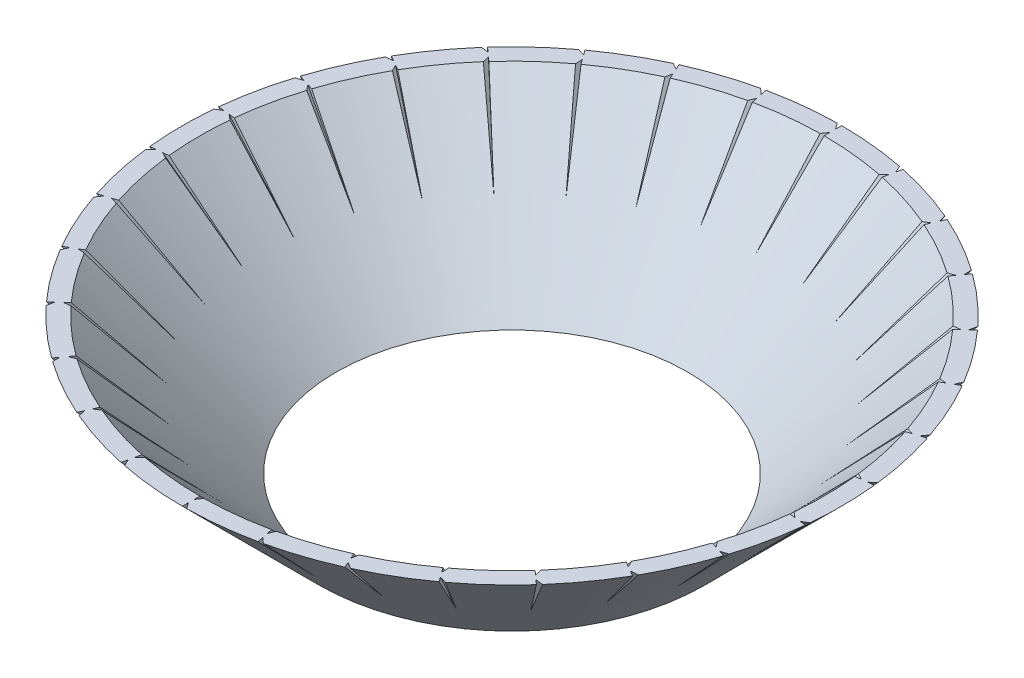
from build123d import *

# Parameters (mm, degrees)
CIRPATTERN1_COUNT = 30


with BuildPart() as part:
    # Sketch1 → Base-Revolve (revolve)
    with BuildSketch(Plane(origin=(0, 0, 0), x_dir=(0, 0, -1), z_dir=(1, 0, 0))):
        Polygon((8.5, 0), (15.1, 6.6), (15.948528137, 6.6), (9.348528137, 0), align=None)
    revolve(axis=Axis((0, -30, 0), (0, 1, 0)))

    # Cut-Sweep1: sweep along a path in Sketch3
    with BuildLine(Plane(origin=(0, 0, 0), x_dir=(0, 0, -1), z_dir=(1, 0, 0))) as cut_sweep1_path:
        Line((11.8, 3.3), (16.464867099, 7.6))
    # Sketch5 → Cut-Sweep1 (sweep, cut)
    with BuildSketch(Plane(origin=(0, 3.3, -11.8), x_dir=(-1, 0, 0), z_dir=(0, 0.6777666558072859, -0.7352770636133076))):
        Polygon((0, 0), (0, 1), (1, 1), align=None)
    cut_sweep1 = sweep(path=cut_sweep1_path.line, mode=Mode.SUBTRACT)

    # Mirror2: Cut-Sweep1 across plane
    add(cut_sweep1.mirror(Plane(origin=(0, -4.462132034, -4.462132034), x_dir=(0, -0.7071067811865461, 0.707106781186549), z_dir=(0, -0.7071067811865489, -0.7071067811865461))), mode=Mode.SUBTRACT)

    # CirPattern1: Cut-Sweep1 ×30 about axis
    cirpattern1_axis = Axis((0, -30, 0), (0, 1, 0))
    for i in range(1, CIRPATTERN1_COUNT):
        add(cut_sweep1.rotate(cirpattern1_axis, i * 360 / CIRPATTERN1_COUNT), mode=Mode.SUBTRACT)

    # CirPattern1 copy 1: sweep along a path in CirPattern1 copy 1 path
    with BuildLine(Plane(origin=(-1.855458832, -8.924264069, -8.729247487), x_dir=(0, 1, 0), z_dir=(0.9781476007338057, 0, -0.20791169081775923))) as cirpattern1_copy_1_path:
        Line((11.8, -3.3), (16.464867099, -7.6))
    # CirPattern1 copy 1 sketch → CirPattern1 copy 1 (sweep, cut)
    with BuildSketch(Plane(origin=(-2.541567412, 2.875735931, -11.95713457), x_dir=(-0.9781476007338057, 0, 0.20791169081775923), z_dir=(-0.14091561138879177, 0.7352770636133049, -0.6629558282352747))):
        Polygon((0, 0), (0, -1), (1, -1), align=None)
    sweep(path=cirpattern1_copy_1_path.line, mode=Mode.SUBTRACT)

    # CirPattern1 copy 2: sweep along a path in CirPattern1 copy 2 path
    with BuildLine(Plane(origin=(-3.629825209, -8.924264069, -8.152720903), x_dir=(0, 1, 0), z_dir=(0.9135454576426009, 0, -0.4067366430758001))) as cirpattern1_copy_2_path:
        Line((11.8, -3.3), (16.464867099, -7.6))
    # CirPattern1 copy 2 sketch → CirPattern1 copy 2 (sweep, cut)
    with BuildSketch(Plane(origin=(-4.972056131, 2.875735931, -11.167420913), x_dir=(-0.9135454576426009, 0, 0.4067366430758001), z_dir=(-0.275672534371768, 0.7352770636133049, -0.6191706497543648))):
        Polygon((0, 0), (0, -1), (1, -1), align=None)
    sweep(path=cirpattern1_copy_2_path.line, mode=Mode.SUBTRACT)

    # CirPattern1 copy 3: sweep along a path in CirPattern1 copy 3 path
    with BuildLine(Plane(origin=(-5.245550807, -8.924264069, -7.219881294), x_dir=(0, 1, 0), z_dir=(0.8090169943749476, 0, -0.587785252292473))) as cirpattern1_copy_3_path:
        Line((11.8, -3.3), (16.464867099, -7.6))
    # CirPattern1 copy 3 sketch → CirPattern1 copy 3 (sweep, cut)
    with BuildSketch(Plane(origin=(-7.18524214, 2.875735931, -9.889637375), x_dir=(-0.8090169943749476, 0, 0.587785252292473), z_dir=(-0.3983812447791131, 0.7352770636133049, -0.5483247427687724))):
        Polygon((0, 0), (0, -1), (1, -1), align=None)
    sweep(path=cirpattern1_copy_3_path.line, mode=Mode.SUBTRACT)

    # CirPattern1 copy 4: sweep along a path in CirPattern1 copy 4 path
    with BuildLine(Plane(origin=(-6.632020664, -8.924264069, -5.971498228), x_dir=(0, 1, 0), z_dir=(0.6691306063588583, 0, -0.7431448254773941))) as cirpattern1_copy_4_path:
        Line((11.8, -3.3), (16.464867099, -7.6))
    # CirPattern1 copy 4 sketch → CirPattern1 copy 4 (sweep, cut)
    with BuildSketch(Plane(origin=(-9.084398588, 2.875735931, -8.179629229), x_dir=(-0.6691306063588583, 0, 0.7431448254773941), z_dir=(-0.5036787831443048, 0.7352770636133049, -0.45351441337014675))):
        Polygon((0, 0), (0, -1), (1, -1), align=None)
    sweep(path=cirpattern1_copy_4_path.line, mode=Mode.SUBTRACT)

    # CirPattern1 copy 5: sweep along a path in CirPattern1 copy 5 path
    with BuildLine(Plane(origin=(-7.728639394, -8.924264069, -4.462132034), x_dir=(0, 1, 0), z_dir=(0.5000000000000002, 0, -0.8660254037844385))) as cirpattern1_copy_5_path:
        Line((11.8, -3.3), (16.464867099, -7.6))
    # CirPattern1 copy 5 sketch → CirPattern1 copy 5 (sweep, cut)
    with BuildSketch(Plane(origin=(-10.586523226, 2.875735931, -6.112132034), x_dir=(-0.5000000000000002, 0, 0.8660254037844385), z_dir=(-0.5869631417671358, 0.7352770636133049, -0.3388833279036445))):
        Polygon((0, 0), (0, -1), (1, -1), align=None)
    sweep(path=cirpattern1_copy_5_path.line, mode=Mode.SUBTRACT)

    # CirPattern1 copy 6: sweep along a path in CirPattern1 copy 6 path
    with BuildLine(Plane(origin=(-8.487479496, -8.924264069, -2.75774926), x_dir=(0, 1, 0), z_dir=(0.30901699437494756, 0, -0.9510565162951535))) as cirpattern1_copy_6_path:
        Line((11.8, -3.3), (16.464867099, -7.6))
    # CirPattern1 copy 6 sketch → CirPattern1 copy 6 (sweep, cut)
    with BuildSketch(Plane(origin=(-11.625965999, 2.875735931, -3.777505341), x_dir=(-0.30901699437494756, 0, 0.9510565162951535), z_dir=(-0.6445943945330965, 0.7352770636133049, -0.20944141486512793))):
        Polygon((0, 0), (0, -1), (1, -1), align=None)
    sweep(path=cirpattern1_copy_6_path.line, mode=Mode.SUBTRACT)

    # CirPattern1 copy 7: sweep along a path in CirPattern1 copy 7 path
    with BuildLine(Plane(origin=(-8.875376016, -8.924264069, -0.932839609), x_dir=(0, 1, 0), z_dir=(0.10452846326765358, 0, -0.9945218953682733))) as cirpattern1_copy_7_path:
        Line((11.8, -3.3), (16.464867099, -7.6))
    # CirPattern1 copy 7 sketch → CirPattern1 copy 7 (sweep, cut)
    with BuildSketch(Plane(origin=(-12.157298271, 2.875735931, -1.277783538), x_dir=(-0.10452846326765358, 0, 0.9945218953682733), z_dir=(-0.6740537791508809, 0.7352770636133049, -0.07084590698559251))):
        Polygon((0, 0), (0, -1), (1, -1), align=None)
    sweep(path=cirpattern1_copy_7_path.line, mode=Mode.SUBTRACT)

    # CirPattern1 copy 8: sweep along a path in CirPattern1 copy 8 path
    with BuildLine(Plane(origin=(-8.875376016, -8.924264069, 0.932839609), x_dir=(0, 1, 0), z_dir=(-0.10452846326765343, 0, -0.9945218953682733))) as cirpattern1_copy_8_path:
        Line((11.8, -3.3), (16.464867099, -7.6))
    # CirPattern1 copy 8 sketch → CirPattern1 copy 8 (sweep, cut)
    with BuildSketch(Plane(origin=(-12.157298271, 2.875735931, 1.277783538), x_dir=(0.10452846326765343, 0, 0.9945218953682733), z_dir=(-0.6740537791508809, 0.7352770636133049, 0.0708459069855926))):
        Polygon((0, 0), (0, -1), (1, -1), align=None)
    sweep(path=cirpattern1_copy_8_path.line, mode=Mode.SUBTRACT)

    # CirPattern1 copy 9: sweep along a path in CirPattern1 copy 9 path
    with BuildLine(Plane(origin=(-8.487479496, -8.924264069, 2.75774926), x_dir=(0, 1, 0), z_dir=(-0.30901699437494723, 0, -0.9510565162951536))) as cirpattern1_copy_9_path:
        Line((11.8, -3.3), (16.464867099, -7.6))
    # CirPattern1 copy 9 sketch → CirPattern1 copy 9 (sweep, cut)
    with BuildSketch(Plane(origin=(-11.625965999, 2.875735931, 3.777505341), x_dir=(0.30901699437494723, 0, 0.9510565162951536), z_dir=(-0.6445943945330965, 0.7352770636133049, 0.20944141486512785))):
        Polygon((0, 0), (0, -1), (1, -1), align=None)
    sweep(path=cirpattern1_copy_9_path.line, mode=Mode.SUBTRACT)

    # CirPattern1 copy 10: sweep along a path in CirPattern1 copy 10 path
    with BuildLine(Plane(origin=(-7.728639394, -8.924264069, 4.462132034), x_dir=(0, 1, 0), z_dir=(-0.49999999999999967, 0, -0.8660254037844388))) as cirpattern1_copy_10_path:
        Line((11.8, -3.3), (16.464867099, -7.6))
    # CirPattern1 copy 10 sketch → CirPattern1 copy 10 (sweep, cut)
    with BuildSketch(Plane(origin=(-10.586523226, 2.875735931, 6.112132034), x_dir=(0.49999999999999967, 0, 0.8660254037844388), z_dir=(-0.586963141767136, 0.7352770636133049, 0.3388833279036443))):
        Polygon((0, 0), (0, -1), (1, -1), align=None)
    sweep(path=cirpattern1_copy_10_path.line, mode=Mode.SUBTRACT)

    # CirPattern1 copy 11: sweep along a path in CirPattern1 copy 11 path
    with BuildLine(Plane(origin=(-6.632020664, -8.924264069, 5.971498228), x_dir=(0, 1, 0), z_dir=(-0.6691306063588581, 0, -0.7431448254773944))) as cirpattern1_copy_11_path:
        Line((11.8, -3.3), (16.464867099, -7.6))
    # CirPattern1 copy 11 sketch → CirPattern1 copy 11 (sweep, cut)
    with BuildSketch(Plane(origin=(-9.084398588, 2.875735931, 8.179629229), x_dir=(0.6691306063588581, 0, 0.7431448254773944), z_dir=(-0.5036787831443048, 0.7352770636133049, 0.45351441337014675))):
        Polygon((0, 0), (0, -1), (1, -1), align=None)
    sweep(path=cirpattern1_copy_11_path.line, mode=Mode.SUBTRACT)

    # CirPattern1 copy 12: sweep along a path in CirPattern1 copy 12 path
    with BuildLine(Plane(origin=(-5.245550807, -8.924264069, 7.219881294), x_dir=(0, 1, 0), z_dir=(-0.8090169943749472, 0, -0.5877852522924734))) as cirpattern1_copy_12_path:
        Line((11.8, -3.3), (16.464867099, -7.6))
    # CirPattern1 copy 12 sketch → CirPattern1 copy 12 (sweep, cut)
    with BuildSketch(Plane(origin=(-7.18524214, 2.875735931, 9.889637375), x_dir=(0.8090169943749472, 0, 0.5877852522924734), z_dir=(-0.3983812447791132, 0.7352770636133049, 0.5483247427687723))):
        Polygon((0, 0), (0, -1), (1, -1), align=None)
    sweep(path=cirpattern1_copy_12_path.line, mode=Mode.SUBTRACT)

    # CirPattern1 copy 13: sweep along a path in CirPattern1 copy 13 path
    with BuildLine(Plane(origin=(-3.629825209, -8.924264069, 8.152720903), x_dir=(0, 1, 0), z_dir=(-0.9135454576426008, 0, -0.40673664307580054))) as cirpattern1_copy_13_path:
        Line((11.8, -3.3), (16.464867099, -7.6))
    # CirPattern1 copy 13 sketch → CirPattern1 copy 13 (sweep, cut)
    with BuildSketch(Plane(origin=(-4.972056131, 2.875735931, 11.167420913), x_dir=(0.9135454576426008, 0, 0.40673664307580054), z_dir=(-0.2756725343717681, 0.7352770636133049, 0.6191706497543649))):
        Polygon((0, 0), (0, -1), (1, -1), align=None)
    sweep(path=cirpattern1_copy_13_path.line, mode=Mode.SUBTRACT)

    # CirPattern1 copy 14: sweep along a path in CirPattern1 copy 14 path
    with BuildLine(Plane(origin=(-1.855458832, -8.924264069, 8.729247487), x_dir=(0, 1, 0), z_dir=(-0.9781476007338057, 0, -0.20791169081775943))) as cirpattern1_copy_14_path:
        Line((11.8, -3.3), (16.464867099, -7.6))
    # CirPattern1 copy 14 sketch → CirPattern1 copy 14 (sweep, cut)
    with BuildSketch(Plane(origin=(-2.541567412, 2.875735931, 11.95713457), x_dir=(0.9781476007338057, 0, 0.20791169081775943), z_dir=(-0.14091561138879172, 0.7352770636133049, 0.6629558282352747))):
        Polygon((0, 0), (0, -1), (1, -1), align=None)
    sweep(path=cirpattern1_copy_14_path.line, mode=Mode.SUBTRACT)

    # CirPattern1 copy 15: sweep along a path in CirPattern1 copy 15 path
    with BuildLine(Plane(origin=(0, -8.924264069, 8.924264069), x_dir=(0, 1, 0), z_dir=(-1, 0, 0))) as cirpattern1_copy_15_path:
        Line((11.8, -3.3), (16.464867099, -7.6))
    # CirPattern1 copy 15 sketch → CirPattern1 copy 15 (sweep, cut)
    with BuildSketch(Plane(origin=(0, 2.875735931, 12.224264069), x_dir=(1, 0, 0), z_dir=(0, 0.7352770636133049, 0.6777666558072888))):
        Polygon((0, 0), (0, -1), (1, -1), align=None)
    sweep(path=cirpattern1_copy_15_path.line, mode=Mode.SUBTRACT)

    # CirPattern1 copy 16: sweep along a path in CirPattern1 copy 16 path
    with BuildLine(Plane(origin=(1.855458832, -8.924264069, 8.729247487), x_dir=(0, 1, 0), z_dir=(-0.9781476007338056, 0, 0.2079116908177594))) as cirpattern1_copy_16_path:
        Line((11.8, -3.3), (16.464867099, -7.6))
    # CirPattern1 copy 16 sketch → CirPattern1 copy 16 (sweep, cut)
    with BuildSketch(Plane(origin=(2.541567412, 2.875735931, 11.95713457), x_dir=(0.9781476007338056, 0, -0.2079116908177594), z_dir=(0.14091561138879188, 0.7352770636133049, 0.6629558282352747))):
        Polygon((0, 0), (0, -1), (1, -1), align=None)
    sweep(path=cirpattern1_copy_16_path.line, mode=Mode.SUBTRACT)

    # CirPattern1 copy 17: sweep along a path in CirPattern1 copy 17 path
    with BuildLine(Plane(origin=(3.629825209, -8.924264069, 8.152720903), x_dir=(0, 1, 0), z_dir=(-0.9135454576426009, 0, 0.4067366430758001))) as cirpattern1_copy_17_path:
        Line((11.8, -3.3), (16.464867099, -7.6))
    # CirPattern1 copy 17 sketch → CirPattern1 copy 17 (sweep, cut)
    with BuildSketch(Plane(origin=(4.972056131, 2.875735931, 11.167420913), x_dir=(0.9135454576426009, 0, -0.4067366430758001), z_dir=(0.275672534371768, 0.7352770636133048, 0.6191706497543648))):
        Polygon((0, 0), (0, -1), (1, -1), align=None)
    sweep(path=cirpattern1_copy_17_path.line, mode=Mode.SUBTRACT)

    # CirPattern1 copy 18: sweep along a path in CirPattern1 copy 18 path
    with BuildLine(Plane(origin=(5.245550807, -8.924264069, 7.219881294), x_dir=(0, 1, 0), z_dir=(-0.8090169943749477, 0, 0.5877852522924729))) as cirpattern1_copy_18_path:
        Line((11.8, -3.3), (16.464867099, -7.6))
    # CirPattern1 copy 18 sketch → CirPattern1 copy 18 (sweep, cut)
    with BuildSketch(Plane(origin=(7.18524214, 2.875735931, 9.889637375), x_dir=(0.8090169943749477, 0, -0.5877852522924729), z_dir=(0.39838124477911296, 0.7352770636133048, 0.5483247427687724))):
        Polygon((0, 0), (0, -1), (1, -1), align=None)
    sweep(path=cirpattern1_copy_18_path.line, mode=Mode.SUBTRACT)

    # CirPattern1 copy 19: sweep along a path in CirPattern1 copy 19 path
    with BuildLine(Plane(origin=(6.632020664, -8.924264069, 5.971498228), x_dir=(0, 1, 0), z_dir=(-0.6691306063588582, 0, 0.7431448254773942))) as cirpattern1_copy_19_path:
        Line((11.8, -3.3), (16.464867099, -7.6))
    # CirPattern1 copy 19 sketch → CirPattern1 copy 19 (sweep, cut)
    with BuildSketch(Plane(origin=(9.084398588, 2.875735931, 8.179629229), x_dir=(0.6691306063588582, 0, -0.7431448254773942), z_dir=(0.5036787831443048, 0.7352770636133049, 0.4535144133701467))):
        Polygon((0, 0), (0, -1), (1, -1), align=None)
    sweep(path=cirpattern1_copy_19_path.line, mode=Mode.SUBTRACT)

    # CirPattern1 copy 20: sweep along a path in CirPattern1 copy 20 path
    with BuildLine(Plane(origin=(7.728639394, -8.924264069, 4.462132034), x_dir=(0, 1, 0), z_dir=(-0.5000000000000006, 0, 0.8660254037844383))) as cirpattern1_copy_20_path:
        Line((11.8, -3.3), (16.464867099, -7.6))
    # CirPattern1 copy 20 sketch → CirPattern1 copy 20 (sweep, cut)
    with BuildSketch(Plane(origin=(10.586523226, 2.875735931, 6.112132034), x_dir=(0.5000000000000006, 0, -0.8660254037844383), z_dir=(0.5869631417671357, 0.7352770636133049, 0.3388833279036447))):
        Polygon((0, 0), (0, -1), (1, -1), align=None)
    sweep(path=cirpattern1_copy_20_path.line, mode=Mode.SUBTRACT)

    # CirPattern1 copy 21: sweep along a path in CirPattern1 copy 21 path
    with BuildLine(Plane(origin=(8.487479496, -8.924264069, 2.75774926), x_dir=(0, 1, 0), z_dir=(-0.3090169943749477, 0, 0.9510565162951535))) as cirpattern1_copy_21_path:
        Line((11.8, -3.3), (16.464867099, -7.6))
    # CirPattern1 copy 21 sketch → CirPattern1 copy 21 (sweep, cut)
    with BuildSketch(Plane(origin=(11.625965999, 2.875735931, 3.777505341), x_dir=(0.3090169943749477, 0, -0.9510565162951535), z_dir=(0.6445943945330965, 0.7352770636133048, 0.209441414865128))):
        Polygon((0, 0), (0, -1), (1, -1), align=None)
    sweep(path=cirpattern1_copy_21_path.line, mode=Mode.SUBTRACT)

    # CirPattern1 copy 22: sweep along a path in CirPattern1 copy 22 path
    with BuildLine(Plane(origin=(8.875376016, -8.924264069, 0.932839609), x_dir=(0, 1, 0), z_dir=(-0.10452846326765348, 0, 0.9945218953682734))) as cirpattern1_copy_22_path:
        Line((11.8, -3.3), (16.464867099, -7.6))
    # CirPattern1 copy 22 sketch → CirPattern1 copy 22 (sweep, cut)
    with BuildSketch(Plane(origin=(12.157298271, 2.875735931, 1.277783538), x_dir=(0.10452846326765348, 0, -0.9945218953682734), z_dir=(0.674053779150881, 0.7352770636133049, 0.07084590698559246))):
        Polygon((0, 0), (0, -1), (1, -1), align=None)
    sweep(path=cirpattern1_copy_22_path.line, mode=Mode.SUBTRACT)

    # CirPattern1 copy 23: sweep along a path in CirPattern1 copy 23 path
    with BuildLine(Plane(origin=(8.875376016, -8.924264069, -0.932839609), x_dir=(0, 1, 0), z_dir=(0.10452846326765286, 0, 0.9945218953682734))) as cirpattern1_copy_23_path:
        Line((11.8, -3.3), (16.464867099, -7.6))
    # CirPattern1 copy 23 sketch → CirPattern1 copy 23 (sweep, cut)
    with BuildSketch(Plane(origin=(12.157298271, 2.875735931, -1.277783538), x_dir=(-0.10452846326765286, 0, -0.9945218953682734), z_dir=(0.674053779150881, 0.7352770636133049, -0.0708459069855922))):
        Polygon((0, 0), (0, -1), (1, -1), align=None)
    sweep(path=cirpattern1_copy_23_path.line, mode=Mode.SUBTRACT)

    # CirPattern1 copy 24: sweep along a path in CirPattern1 copy 24 path
    with BuildLine(Plane(origin=(8.487479496, -8.924264069, -2.75774926), x_dir=(0, 1, 0), z_dir=(0.3090169943749471, 0, 0.9510565162951536))) as cirpattern1_copy_24_path:
        Line((11.8, -3.3), (16.464867099, -7.6))
    # CirPattern1 copy 24 sketch → CirPattern1 copy 24 (sweep, cut)
    with BuildSketch(Plane(origin=(11.625965999, 2.875735931, -3.777505341), x_dir=(-0.3090169943749471, 0, -0.9510565162951536), z_dir=(0.6445943945330965, 0.7352770636133049, -0.2094414148651278))):
        Polygon((0, 0), (0, -1), (1, -1), align=None)
    sweep(path=cirpattern1_copy_24_path.line, mode=Mode.SUBTRACT)

    # CirPattern1 copy 25: sweep along a path in CirPattern1 copy 25 path
    with BuildLine(Plane(origin=(7.728639394, -8.924264069, -4.462132034), x_dir=(0, 1, 0), z_dir=(0.5, 0, 0.8660254037844387))) as cirpattern1_copy_25_path:
        Line((11.8, -3.3), (16.464867099, -7.6))
    # CirPattern1 copy 25 sketch → CirPattern1 copy 25 (sweep, cut)
    with BuildSketch(Plane(origin=(10.586523226, 2.875735931, -6.112132034), x_dir=(-0.5, 0, -0.8660254037844387), z_dir=(0.586963141767136, 0.7352770636133049, -0.3388833279036445))):
        Polygon((0, 0), (0, -1), (1, -1), align=None)
    sweep(path=cirpattern1_copy_25_path.line, mode=Mode.SUBTRACT)

    # CirPattern1 copy 26: sweep along a path in CirPattern1 copy 26 path
    with BuildLine(Plane(origin=(6.632020664, -8.924264069, -5.971498228), x_dir=(0, 1, 0), z_dir=(0.6691306063588577, 0, 0.7431448254773947))) as cirpattern1_copy_26_path:
        Line((11.8, -3.3), (16.464867099, -7.6))
    # CirPattern1 copy 26 sketch → CirPattern1 copy 26 (sweep, cut)
    with BuildSketch(Plane(origin=(9.084398588, 2.875735931, -8.179629229), x_dir=(-0.6691306063588577, 0, -0.7431448254773947), z_dir=(0.503678783144305, 0.7352770636133049, -0.4535144133701465))):
        Polygon((0, 0), (0, -1), (1, -1), align=None)
    sweep(path=cirpattern1_copy_26_path.line, mode=Mode.SUBTRACT)

    # CirPattern1 copy 27: sweep along a path in CirPattern1 copy 27 path
    with BuildLine(Plane(origin=(5.245550807, -8.924264069, -7.219881294), x_dir=(0, 1, 0), z_dir=(0.8090169943749472, 0, 0.5877852522924735))) as cirpattern1_copy_27_path:
        Line((11.8, -3.3), (16.464867099, -7.6))
    # CirPattern1 copy 27 sketch → CirPattern1 copy 27 (sweep, cut)
    with BuildSketch(Plane(origin=(7.18524214, 2.875735931, -9.889637375), x_dir=(-0.8090169943749472, 0, -0.5877852522924735), z_dir=(0.39838124477911324, 0.7352770636133049, -0.5483247427687723))):
        Polygon((0, 0), (0, -1), (1, -1), align=None)
    sweep(path=cirpattern1_copy_27_path.line, mode=Mode.SUBTRACT)

    # CirPattern1 copy 28: sweep along a path in CirPattern1 copy 28 path
    with BuildLine(Plane(origin=(3.629825209, -8.924264069, -8.152720903), x_dir=(0, 1, 0), z_dir=(0.913545457642601, 0, 0.40673664307580026))) as cirpattern1_copy_28_path:
        Line((11.8, -3.3), (16.464867099, -7.6))
    # CirPattern1 copy 28 sketch → CirPattern1 copy 28 (sweep, cut)
    with BuildSketch(Plane(origin=(4.972056131, 2.875735931, -11.167420913), x_dir=(-0.913545457642601, 0, -0.40673664307580026), z_dir=(0.2756725343717679, 0.7352770636133049, -0.619170649754365))):
        Polygon((0, 0), (0, -1), (1, -1), align=None)
    sweep(path=cirpattern1_copy_28_path.line, mode=Mode.SUBTRACT)

    # CirPattern1 copy 29: sweep along a path in CirPattern1 copy 29 path
    with BuildLine(Plane(origin=(1.855458832, -8.924264069, -8.729247487), x_dir=(0, 1, 0), z_dir=(0.9781476007338056, 0, 0.20791169081775998))) as cirpattern1_copy_29_path:
        Line((11.8, -3.3), (16.464867099, -7.6))
    # CirPattern1 copy 29 sketch → CirPattern1 copy 29 (sweep, cut)
    with BuildSketch(Plane(origin=(2.541567412, 2.875735931, -11.95713457), x_dir=(-0.9781476007338056, 0, -0.20791169081775998), z_dir=(0.1409156113887921, 0.7352770636133049, -0.6629558282352747))):
        Polygon((0, 0), (0, -1), (1, -1), align=None)
    sweep(path=cirpattern1_copy_29_path.line, mode=Mode.SUBTRACT)


solid = part.part
